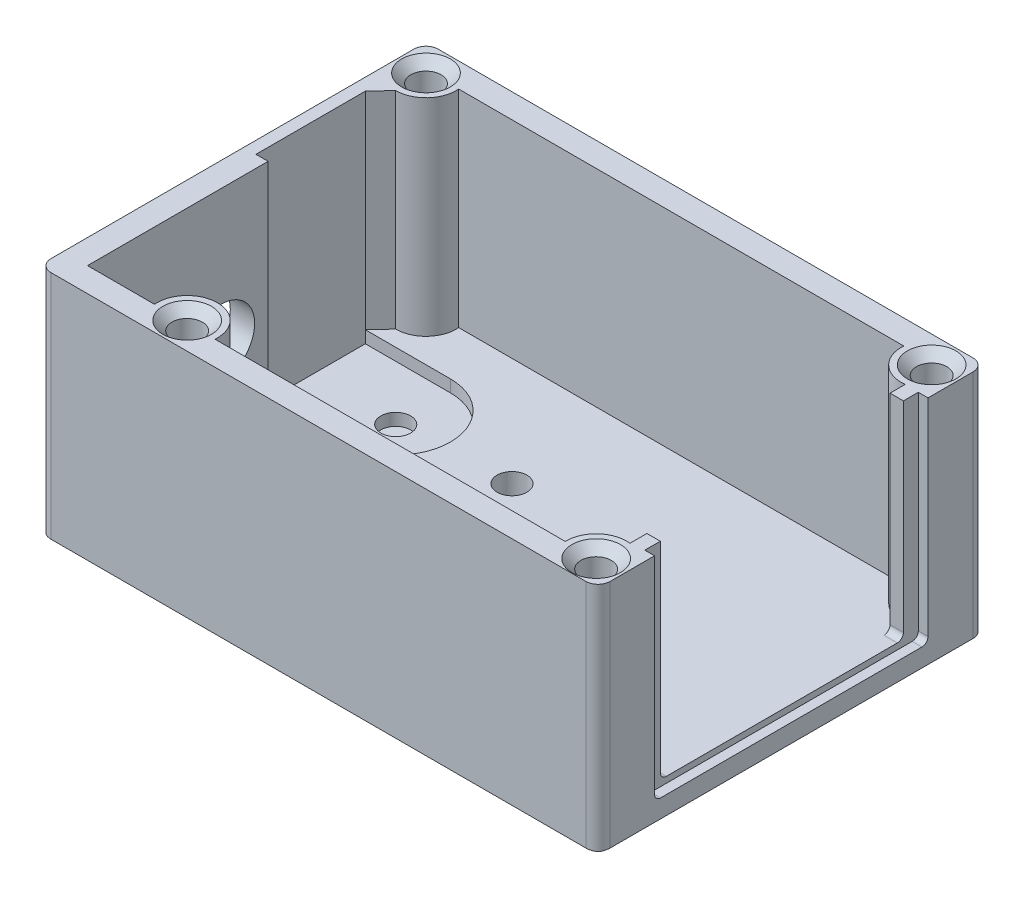
from build123d import *

# Parameters (mm, degrees)
SKETCH1_W                                            = 46
SKETCH1_H                                            = 31.85
BOSS_EXTRUDE1_DEPTH                                  = 20
CSK_FOR_M6_HEX_SOCKET_COUNTERSUNK_CAP_SC_D           = 2.5
CSK_FOR_M6_HEX_SOCKET_COUNTERSUNK_CAP_SC_DEPTH       = 17
CSK_FOR_M6_HEX_SOCKET_COUNTERSUNK_CAP_SC_CSINK_D     = 4
CSK_FOR_M6_HEX_SOCKET_COUNTERSUNK_CAP_SC_CSINK_ANGLE = 90
CSK_FOR_M6_HEX_SOCKET_COUNTERSUNK_CAP_SC_TIP         = 0.751075774
CUT_EXTRUDE1_DEPTH                                   = 17
SKETCH9_W                                            = 22.5
SKETCH9_H                                            = 17.5
CUT_EXTRUDE2_DEPTH                                   = 0.8
FILLET1_R                                            = 1
CHAMFER3_SIZE                                        = 5
CHAMFER3_SIZE_2                                      = 1
CHAMFER4_SIZE                                        = 5
CHAMFER4_SIZE_2                                      = 1
SKETCH15_W                                           = 1.1
SKETCH15_H                                           = 1.710862934
BOSS_EXTRUDE2_DEPTH                                  = 17
FILLET2_R                                            = 0.5
SKETCH16_R                                           = 1.225
CUT_EXTRUDE5_DEPTH                                   = 2
CUT_EXTRUDE6_DEPTH                                   = 1
SKETCH18_R                                           = 3
SKETCH18_R_2                                         = 1.225
BOSS_EXTRUDE3_DEPTH                                  = 2
SKETCH19_R                                           = 2.75
CUT_EXTRUDE7_DEPTH                                   = 51.888167829
SKETCH20_R                                           = 6.5
BOSS_EXTRUDE4_DEPTH                                  = 0.5


with BuildPart() as part:
    # Sketch1 → Boss-Extrude1 (new body)
    with BuildSketch(Plane(origin=(0, 0, 0), x_dir=(1, 0, 0), z_dir=(0, 1, 0))):
        Rectangle(SKETCH1_W, SKETCH1_H)
    extrude(amount=BOSS_EXTRUDE1_DEPTH)

    # CSK for M6 Hex Socket Countersunk Cap Screw1
    with Locations(Plane(origin=(0, 20, 0), x_dir=(1, 0, 0), z_dir=(0, 1, 0))):
        with Locations((-20.8, 13.725), (-13, -13.725), (20.8, 13.725), (20.8, -13.876947284)):
            CounterSinkHole(CSK_FOR_M6_HEX_SOCKET_COUNTERSUNK_CAP_SC_D / 2, CSK_FOR_M6_HEX_SOCKET_COUNTERSUNK_CAP_SC_CSINK_D / 2, depth=CSK_FOR_M6_HEX_SOCKET_COUNTERSUNK_CAP_SC_DEPTH, counter_sink_angle=CSK_FOR_M6_HEX_SOCKET_COUNTERSUNK_CAP_SC_CSINK_ANGLE)
            with Locations((0, 0, -(CSK_FOR_M6_HEX_SOCKET_COUNTERSUNK_CAP_SC_DEPTH + CSK_FOR_M6_HEX_SOCKET_COUNTERSUNK_CAP_SC_TIP / 2))):  # 118° drill point
                Cone(0, CSK_FOR_M6_HEX_SOCKET_COUNTERSUNK_CAP_SC_D / 2, CSK_FOR_M6_HEX_SOCKET_COUNTERSUNK_CAP_SC_TIP, mode=Mode.SUBTRACT)

    # Sketch8 → Cut-Extrude1 (cut)
    with BuildSketch(Plane(origin=(0, 20, 0), x_dir=(1, 0, 0), z_dir=(0, 1, 0))):
        with BuildLine():
            Line((-21, 0.935), (-22, 0.935))
            Line((-22, 0.935), (-22, 9.935))
            Line((-22, 9.935), (-20.8, 11.225))
            ThreePointArc((-20.8, 11.225), (-18.962882693, 12.029417504), (-18.308012841, 13.925))
            Line((-18.308012841, 13.925), (18.308012841, 13.925))
            ThreePointArc((18.308012841, 13.925), (19.142606811, 11.853356921), (21.3, 11.275510257))
            Line((21.3, 11.275510257), (22.2, 11.225))
            Line((22.2, 11.225), (22.2, -11.427457541))
            Line((22.2, -11.427457541), (21.3, -11.427457541))
            ThreePointArc((21.3, -11.427457541), (19.200322601, -11.955741356), (18.300461855, -13.925))
            Line((18.300461855, -13.925), (-10.508012841, -13.925))
            ThreePointArc((-10.508012841, -13.925), (-13, -11.225), (-15.491987159, -13.925))
            Line((-15.491987159, -13.925), (-21, -13.925))
            Line((-21, -13.925), (-21, 0.935))
        make_face()
    extrude(amount=-CUT_EXTRUDE1_DEPTH, mode=Mode.SUBTRACT)

    # Sketch9 → Cut-Extrude2 (cut)
    with BuildSketch(Plane(origin=(23, 0, 0), x_dir=(0, 0, -1), z_dir=(1, 0, 0))):
        with Locations((-0.02414151, 11.25)):
            Rectangle(SKETCH9_W, SKETCH9_H)
    extrude(amount=-CUT_EXTRUDE2_DEPTH, mode=Mode.SUBTRACT)

    # Fillet1
    fillet1_edges = [part.edges().sort_by_distance(p)[0] for p in [
        (23, 10, 15.925),
        (-23, 10, 15.925),
        (-23, 10, -15.925),
        (23, 10, -15.925),
    ]]
    fillet(fillet1_edges, radius=FILLET1_R)

    # Chamfer3
    # the kernel refuses this chamfer: 5, 1 mm, written as the material it takes off along each edge
    with BuildSketch(Plane(origin=(23, 0, 27.915660431), x_dir=(-0.9999715107910817, -0.007548351224040629, 0), z_dir=(0, 0, -1))) as chamfer3_piece_1:
        Polygon((CHAMFER3_SIZE * 0.999971510791, CHAMFER3_SIZE * 0.00754835122404), (-CHAMFER3_SIZE_2 * 0.00754835122404, CHAMFER3_SIZE_2 * 0.999971510791), (0, 0), align=None)
    extrude(amount=55.831320863, mode=Mode.SUBTRACT)

    # Chamfer4
    # the kernel refuses this chamfer: 5, 1 mm, written as the material it takes off along each edge
    with BuildSketch(Plane(origin=(30.990660431, 0, -15.925), x_dir=(0, -0.007548351224040629, 0.9999715107910817), z_dir=(-1, 0, 0))) as chamfer4_piece_1:
        Polygon((CHAMFER4_SIZE * 0.999971510791, CHAMFER4_SIZE * 0.00754835122404), (-CHAMFER4_SIZE_2 * 0.00754835122404, CHAMFER4_SIZE_2 * 0.999971510791), (0, 0), align=None)
    extrude(amount=65.981320863, mode=Mode.SUBTRACT)
    with BuildSketch(Plane(origin=(-34.990660431, 0, 15.925), x_dir=(0, 0.9826554028509425, 0.18544098588999117), z_dir=(1, 0, 0))) as chamfer4_piece_2:
        Polygon((CHAMFER4_SIZE_2 * 0.982655402851, -CHAMFER4_SIZE_2 * 0.18544098589), (-CHAMFER4_SIZE * 0.18544098589, -CHAMFER4_SIZE * 0.982655402851), (0, 0), align=None)
    extrude(amount=65.981320863, mode=Mode.SUBTRACT)

    # Sketch15 → Boss-Extrude2 (add)
    with BuildSketch(Plane(origin=(0, 3, 0), x_dir=(1, 0, 0), z_dir=(0, 1, 0))):
        with Locations((21.65, 10.855431467)):
            Rectangle(SKETCH15_W, SKETCH15_H)
        with Locations((21.65, -10.855431467)):
            Rectangle(SKETCH15_W, SKETCH15_H)
    extrude(amount=BOSS_EXTRUDE2_DEPTH)

    # Fillet2
    fillet2_edges = [part.edges().sort_by_distance(p)[0] for p in [
        (21.65, 3, -10),
        (21.65, 3, 10),
        (22.6, 2.5, 11.27414151),
        (22.6, 2.5, -11.22585849),
    ]]
    fillet(fillet2_edges, radius=FILLET2_R)

    # Sketch16 → Cut-Extrude5 (cut)
    with BuildSketch(Plane(origin=(0, 3, 0), x_dir=(1, 0, 0), z_dir=(0, 1, 0))):
        with Locations(Location((-15, 5.435, 0), (0, 0, 270))):
            Circle(SKETCH16_R)
        with Locations(Location((-5, 5, 0), (0, 0, 270))):
            Circle(SKETCH16_R)
        with Locations(Location((-5, -5, 0), (0, 0, 90))):
            Circle(SKETCH16_R)
    extrude(amount=-CUT_EXTRUDE5_DEPTH, mode=Mode.SUBTRACT)

    # Sketch17 → Cut-Extrude6 (cut)
    with BuildSketch(Plane(origin=(0, 3, 0), x_dir=(1, 0, 0), z_dir=(0, 1, 0))):
        with BuildLine():
            Line((-22, 0.935), (-22, 9.935))
            Line((-22, 9.935), (-15, 9.935))
            ThreePointArc((-15, 9.935), (-10.5, 5.435), (-15, 0.935))
            Line((-15, 0.935), (-22, 0.935))
        make_face()
    extrude(amount=-CUT_EXTRUDE6_DEPTH, mode=Mode.SUBTRACT)

    # Sketch18 → Boss-Extrude3 (add)
    with BuildSketch(Plane(origin=(0, 3, 0), x_dir=(1, 0, 0), z_dir=(0, 1, 0))):
        with Locations(Location((7.81, 0, 0), (0, 0, 270))):
            Circle(SKETCH18_R)
        with Locations(Location((7.81, 0, 0), (0, 0, 270))):
            Circle(SKETCH18_R_2, mode=Mode.SUBTRACT)
    extrude(amount=BOSS_EXTRUDE3_DEPTH)

    # Sketch19 → Cut-Extrude7 (cut, through all)
    with BuildSketch(Plane(origin=(-21, 0, 0), x_dir=(0, 0, -1), z_dir=(1, 0, 0))):
        with Locations((-2.925, 9)):
            Circle(SKETCH19_R)
    extrude(amount=-CUT_EXTRUDE7_DEPTH, mode=Mode.SUBTRACT)

    # Sketch20 → Boss-Extrude4 (add)
    with BuildSketch(Plane.XZ):
        with Locations(Location((7.81, 0, 0), (0, 0, 270))):
            Circle(SKETCH20_R)
    extrude(amount=BOSS_EXTRUDE4_DEPTH)


solid = part.part
